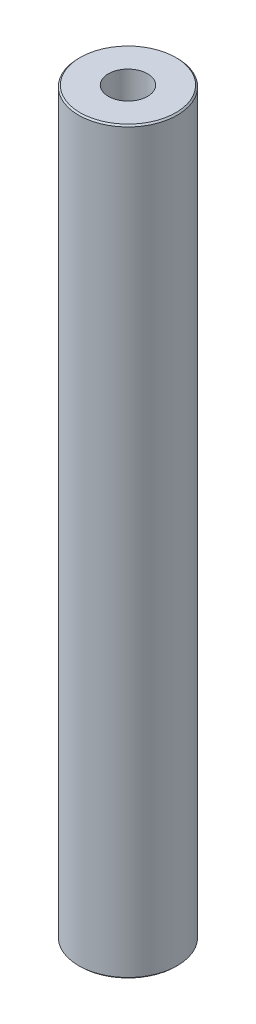
from build123d import *

# Parameters (mm, degrees)
SKETCH1_R           = 40
BOSS_EXTRUDE1_DEPTH = 600
SKETCH2_R           = 15.920469421
CUT_EXTRUDE1_DEPTH  = 603.660766933
CHAMFER1_SIZE       = 1.178784547


with BuildPart() as part:
    # Sketch1 → Boss-Extrude1 (new body)
    with BuildSketch(Plane(origin=(0, 0, 0), x_dir=(1, 0, 0), z_dir=(0, 1, 0))):
        Circle(SKETCH1_R)
    extrude(amount=BOSS_EXTRUDE1_DEPTH)

    # Sketch2 → Cut-Extrude1 (cut, through all)
    with BuildSketch(Plane(origin=(0, 0, 0), x_dir=(1, 0, 0), z_dir=(0, 1, 0))):
        Circle(SKETCH2_R)
    extrude(amount=CUT_EXTRUDE1_DEPTH, mode=Mode.SUBTRACT)

    # Chamfer1
    chamfer1_edges = [part.edges().sort_by_distance(p)[0] for p in [
        (-40, 600, 0),
        (-40, 0, 0),
    ]]
    chamfer(chamfer1_edges, length=CHAMFER1_SIZE)


solid = part.part
